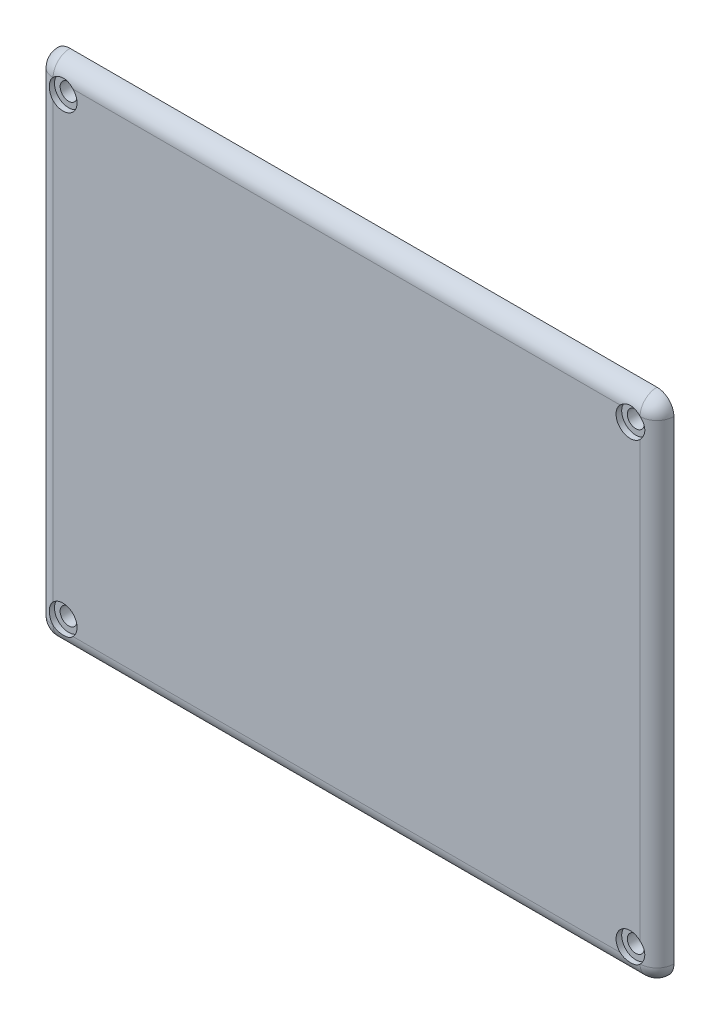
from build123d import *

# Parameters (mm, degrees)
BOSS_EXTRUDE1_DEPTH = 3
FILLET3_R           = 3
SKETCH2_R           = 1.5
CUT_EXTRUDE1_DEPTH  = 72.126647608
SKETCH3_R           = 2.5
CUT_EXTRUDE2_DEPTH  = 1


with BuildPart() as part:
    # Sketch1 → Boss-Extrude1 (new body)
    with BuildSketch(Plane.XY):
        with BuildLine():
            Line((52, -45), (-52, -45))
            ThreePointArc((-52, -45), (-54.121320344, -44.121320344), (-55, -42))
            Line((-55, -42), (-55, 42))
            ThreePointArc((-55, 42), (-54.121320344, 44.121320344), (-52, 45))
            Line((-52, 45), (52, 45))
            ThreePointArc((52, 45), (54.121320344, 44.121320344), (55, 42))
            Line((55, 42), (55, -42))
            ThreePointArc((55, -42), (54.121320344, -44.121320344), (52, -45))
        make_face()
    extrude(amount=BOSS_EXTRUDE1_DEPTH)

    # Fillet3
    fillet3_edges = [part.edges().sort_by_distance(p)[0] for p in [
        (0, -45, 3),
        (-54.121320344, -44.121320344, 3),
        (-55, 0, 3),
        (-54.121320344, 44.121320344, 3),
        (0, 45, 3),
        (54.121320344, 44.121320344, 3),
        (55, 0, 3),
        (54.121320344, -44.121320344, 3),
    ]]
    fillet(fillet3_edges, radius=FILLET3_R - 0.0001)  # a hair under: the kernel refuses the full size

    # Sketch2 → Cut-Extrude1 (cut, through all)
    with BuildSketch(Plane.XY.offset(3)):
        with Locations((-50.25, 40.25)):
            Circle(SKETCH2_R)
        with Locations((50.25, 40.25)):
            Circle(SKETCH2_R)
        with Locations((-50.25, -40.25)):
            Circle(SKETCH2_R)
        with Locations((50.25, -40.25)):
            Circle(SKETCH2_R)
    extrude(amount=-CUT_EXTRUDE1_DEPTH, mode=Mode.SUBTRACT)

    # Sketch3 → Cut-Extrude2 (cut)
    with BuildSketch(Plane.XY.offset(3)):
        with Locations((-50.25, 40.25)):
            Circle(SKETCH3_R)
        with Locations((50.25, 40.25)):
            Circle(SKETCH3_R)
        with Locations((-50.25, -40.25)):
            Circle(SKETCH3_R)
        with Locations((50.25, -40.25)):
            Circle(SKETCH3_R)
    extrude(amount=-CUT_EXTRUDE2_DEPTH, mode=Mode.SUBTRACT)


solid = part.part
